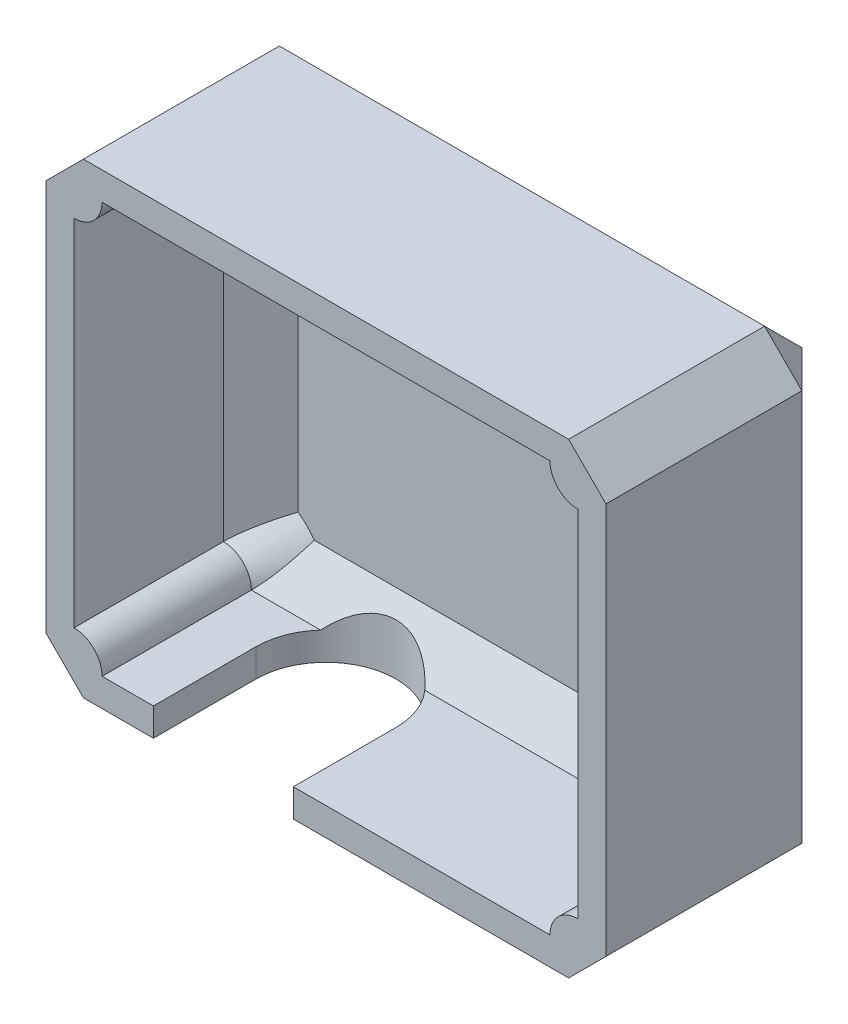
from build123d import *

# Parameters (mm, degrees)
SKETCH1_W           = 60
SKETCH1_H           = 50
BOSS_EXTRUDE1_DEPTH = 5
SKETCH2_W           = 60
SKETCH2_H           = 50
BOSS_EXTRUDE2_DEPTH = 20
CHAMFER1_SIZE       = 4
CHAMFER2_SIZE       = 4
CUT_EXTRUDE1_REACH  = 84.006


with BuildPart() as part:
    # Sketch1 → Boss-Extrude1 (new body)
    with BuildSketch(Plane.XY):
        with Locations((30, 25)):
            Rectangle(SKETCH1_W, SKETCH1_H)
    extrude(amount=BOSS_EXTRUDE1_DEPTH)

    # Sketch2 → Boss-Extrude2 (add)
    with BuildSketch(Plane.XY.offset(5)):
        with Locations((30, 25)):
            Rectangle(SKETCH2_W, SKETCH2_H)
        with BuildLine():
            ThreePointArc((57, 6), (54.878679656, 5.121320344), (54, 3))
            Line((54, 3), (6, 3))
            ThreePointArc((6, 3), (5.121320344, 5.121320344), (3, 6))
            Line((3, 6), (3, 44))
            ThreePointArc((3, 44), (5.121320344, 44.878679656), (6, 47))
            Line((6, 47), (54, 47))
            ThreePointArc((54, 47), (54.878679656, 44.878679656), (57, 44))
            Line((57, 44), (57, 6))
        make_face(mode=Mode.SUBTRACT)
    extrude(amount=BOSS_EXTRUDE2_DEPTH)

    # Chamfer1
    chamfer1_edges = [part.edges().sort_by_distance(p)[0] for p in [
        (30, 3, 5),
        (5.121320344, 5.121320344, 5),
        (3, 25, 5),
        (5.121320344, 44.878679656, 5),
        (30, 47, 5),
        (54.878679656, 44.878679656, 5),
        (57, 25, 5),
        (54.878679656, 5.121320344, 5),
    ]]
    chamfer(chamfer1_edges, length=CHAMFER1_SIZE)

    # Chamfer2
    chamfer2_edges = [part.edges().sort_by_distance(p)[0] for p in [
        (60, 25, 0),
        (60, 50, 12.5),
        (30, 50, 0),
        (0, 50, 12.5),
        (0, 25, 0),
        (60, 0, 12.5),
        (30, 0, 0),
        (0, 0, 12.5),
    ]]
    chamfer(chamfer2_edges, length=CHAMFER2_SIZE)

    # Sketch3 → Cut-Extrude1 (cut, up to next)
    with BuildSketch(Plane.XZ, mode=Mode.PRIVATE) as cut_extrude1_sk1:
        with BuildLine():
            Line((11.5, 25), (11.5, 14))
            ThreePointArc((11.5, 14), (19, 6.5), (26.5, 14))
            Line((26.5, 14), (26.5, 25))
            Line((26.5, 25), (11.5, 25))
        make_face()
    cut_extrude1_tool1 = extrude(cut_extrude1_sk1.sketch, amount=-CUT_EXTRUDE1_REACH, mode=Mode.PRIVATE) & part.part
    add(cut_extrude1_tool1.solids().sort_by_distance((19, 0, 16.471806))[0], mode=Mode.SUBTRACT)


solid = part.part
